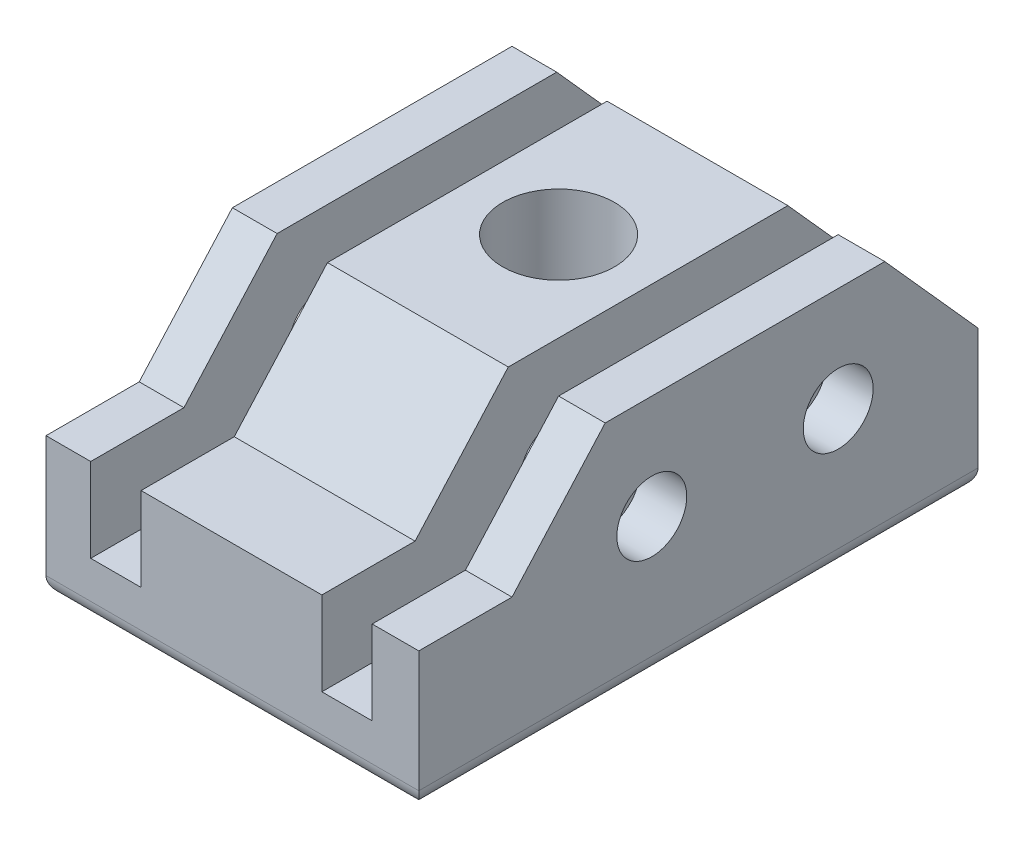
from build123d import *

# Parameters (mm, degrees)
SKETCH1_W           = 63.5
SKETCH1_H           = 6.35
BOSS_EXTRUDE1_DEPTH = 50.8
BOSS_EXTRUDE2_DEPTH = 50.8
SKETCH10_W          = 6.858
SKETCH10_H          = 25.629031657
CUT_EXTRUDE1_DEPTH  = 88.854357354
LPATTERN3_COUNT     = 2
LPATTERN3_PITCH     = 31.496
SKETCH11_R          = 4.7625
CUT_EXTRUDE2_DEPTH  = 88.854357354
BOSS_EXTRUDE3_DEPTH = 12.7
SKETCH23_R          = 7.62
CUT_EXTRUDE6_DEPTH  = 88.854357354
FILLET2_R           = 2.54
SKETCH24_R          = 3.175
CUT_EXTRUDE7_DEPTH  = 10


with BuildPart() as part:
    # Sketch1 → Boss-Extrude1 (new body)
    with BuildSketch(Plane(origin=(0, 0, 0), x_dir=(0, 0, -1), z_dir=(1, 0, 0))):
        with Locations((31.75, 3.175)):
            Rectangle(SKETCH1_W, SKETCH1_H)
    extrude(amount=-BOSS_EXTRUDE1_DEPTH)

    # Sketch2 → Boss-Extrude2 (add)
    with BuildSketch(Plane(origin=(0, 0, 0), x_dir=(0, 0, -1), z_dir=(1, 0, 0))):
        Polygon((0, 6.35), (0, 19.05), (12.7, 33.249031657), (50.8, 33.249031657), (63.5, 19.05), (63.5, 6.35), align=None)
    extrude(amount=-BOSS_EXTRUDE2_DEPTH)

    # Sketch10 → Cut-Extrude1 (cut, through all)
    with BuildSketch(Plane(origin=(0, 0, -63.5), x_dir=(-1, 0, 0), z_dir=(0, 0, -1))):
        with Locations((9.779, 20.434515829)):
            Rectangle(SKETCH10_W, SKETCH10_H)
    cut_extrude1 = extrude(amount=-CUT_EXTRUDE1_DEPTH, mode=Mode.SUBTRACT)

    # LPattern3: Cut-Extrude1 ×2
    with Locations(*[(-i * LPATTERN3_PITCH, 0, 0) for i in range(1, LPATTERN3_COUNT)]):
        add(cut_extrude1, mode=Mode.SUBTRACT)

    # Sketch11 → Cut-Extrude2 (cut, through all)
    with BuildSketch(Plane(origin=(0, 0, 0), x_dir=(0, 0, -1), z_dir=(1, 0, 0))):
        with Locations((19.05, 19.05)):
            Circle(SKETCH11_R)
        with Locations((44.45, 19.05)):
            Circle(SKETCH11_R)
    extrude(amount=-CUT_EXTRUDE2_DEPTH, mode=Mode.SUBTRACT)

    # Sketch22 → Boss-Extrude3 (add)
    with BuildSketch(Plane.XY):
        Polygon((0, 0), (-50.8, 0), (-50.8, 7.62), (-50.8, 19.05), (-44.704, 19.05), (-44.704, 7.62), (-37.846, 7.62), (-37.846, 19.05), (-13.208, 19.05), (-13.208, 7.62), (-6.35, 7.62), (-6.35, 19.05), (0, 19.05), (0, 7.62), align=None)
    extrude(amount=BOSS_EXTRUDE3_DEPTH)

    # Sketch23 → Cut-Extrude6 (cut, through all)
    with BuildSketch(Plane(origin=(0, 33.249031657, 0), x_dir=(1, 0, 0), z_dir=(0, 1, 0))):
        with Locations((-25.4, 31.75)):
            Circle(SKETCH23_R)
    extrude(amount=-CUT_EXTRUDE6_DEPTH, mode=Mode.SUBTRACT)

    # Fillet2
    fillet2_edges = [part.edges().sort_by_distance(p)[0] for p in [
        (-25.4, 0, -63.5),
        (-50.8, 0, -25.4),
        (-25.4, 0, 12.7),
        (0, 0, -25.4),
    ]]
    fillet(fillet2_edges, radius=FILLET2_R)

    # Sketch24 → Cut-Extrude7 (cut)
    with BuildSketch(Plane.XZ):
        with Locations((-30.4, -46.15)):
            Circle(SKETCH24_R)
        with Locations((-20.4, -46.15)):
            Circle(SKETCH24_R)
        with Locations((-20.4, 3.35)):
            Circle(SKETCH24_R)
        with Locations((-30.4, 3.35)):
            Circle(SKETCH24_R)
    extrude(amount=-CUT_EXTRUDE7_DEPTH, mode=Mode.SUBTRACT)


solid = part.part
